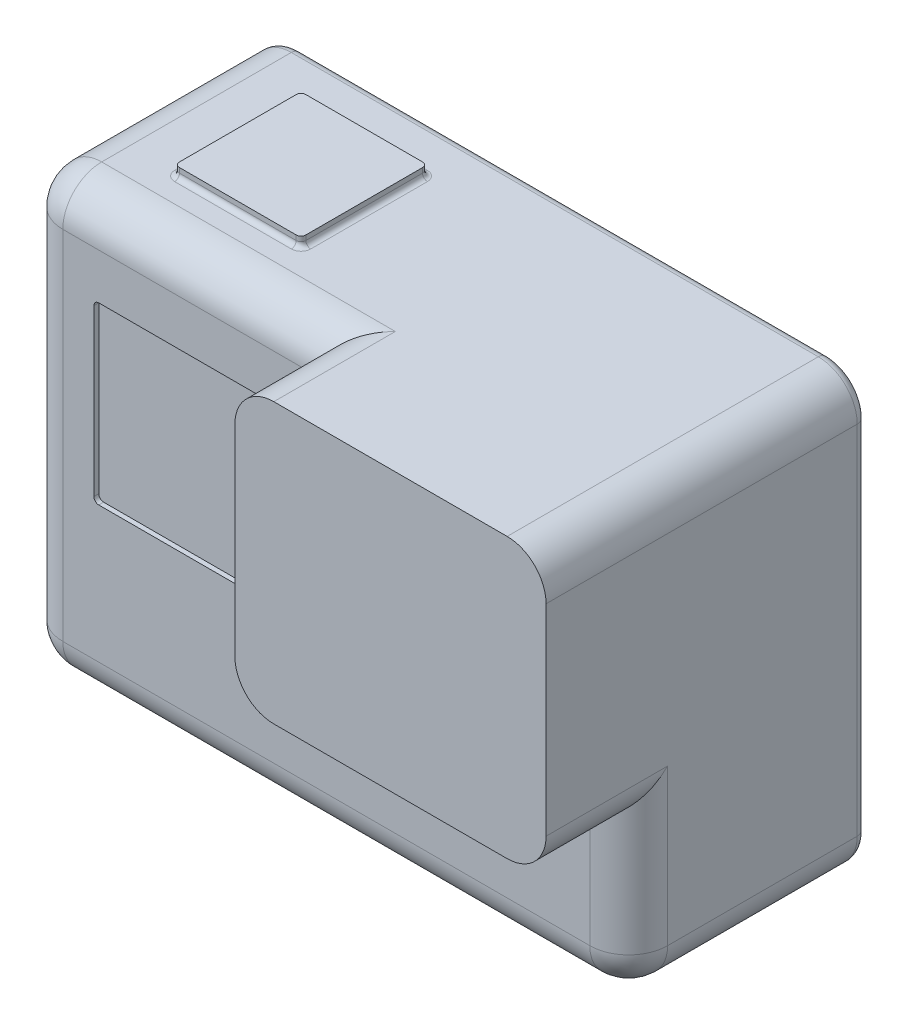
from build123d import *

# Parameters (mm, degrees)
CROQUIS1_W              = 62.2
CROQUIS1_H              = 44.7
SALIENTE_EXTRUIR1_DEPTH = 24.5
CROQUIS2_W              = 32
CROQUIS2_H              = 28.7
SALIENTE_EXTRUIR2_DEPTH = 8.5
CROQUIS3_W              = 18
CROQUIS3_H              = 18
CORTAR_EXTRUIR1_DEPTH   = 0.5
CROQUIS4_W              = 13
CROQUIS4_H              = 13
SALIENTE_EXTRUIR3_DEPTH = 1
REDONDEO2_R             = 0.5
REDONDEO3_R             = 1
REDONDEO1_R             = 4


with BuildPart() as part:
    # Croquis1 → Saliente-Extruir1 (new body)
    with BuildSketch(Plane.XY):
        with Locations((-31.1, 22.35)):
            Rectangle(CROQUIS1_W, CROQUIS1_H)
    extrude(amount=SALIENTE_EXTRUIR1_DEPTH)

    # Croquis2 → Saliente-Extruir2 (add)
    with BuildSketch(Plane.XY.offset(24.5)):
        with Locations((-16, 30.35)):
            Rectangle(CROQUIS2_W, CROQUIS2_H)
    extrude(amount=SALIENTE_EXTRUIR2_DEPTH)

    # Croquis3 → Cortar-Extruir1 (cut)
    with BuildSketch(Plane.XY.offset(24.5)):
        with Locations((-46, 27)):
            Rectangle(CROQUIS3_W, CROQUIS3_H)
    extrude(amount=-CORTAR_EXTRUIR1_DEPTH, mode=Mode.SUBTRACT)

    # Croquis4 → Saliente-Extruir3 (add)
    with BuildSketch(Plane(origin=(0, 44.7, 0), x_dir=(1, 0, 0), z_dir=(0, 1, 0))):
        with Locations((-46.7, -11.5)):
            Rectangle(CROQUIS4_W, CROQUIS4_H)
    extrude(amount=SALIENTE_EXTRUIR3_DEPTH)

    # Redondeo2
    redondeo2_edges = [part.edges().sort_by_distance(p)[0] for p in [
        (-55, 18, 24.25),
        (-55, 36, 24.25),
        (-37, 36, 24.25),
        (-37, 18, 24.25),
        (-40.2, 44.7, 11.5),
        (-40.2, 45.2, 18),
        (-46.7, 44.7, 5),
        (-40.2, 45.2, 5),
        (-53.2, 44.7, 11.5),
        (-53.2, 45.2, 5),
        (-46.7, 44.7, 18),
        (-53.2, 45.2, 18),
    ]]
    fillet(redondeo2_edges, radius=REDONDEO2_R)

    # Redondeo3
    redondeo3_edges = [part.edges().sort_by_distance(p)[0] for p in [
        (-31.1, 0, 0),
        (-62.2, 22.35, 0),
        (-31.1, 44.7, 0),
        (0, 22.35, 0),
    ]]
    fillet(redondeo3_edges, radius=REDONDEO3_R)

    # Redondeo1
    # the kernel refuses this fillet: 4 mm, written as the material it takes off along each edge
    with BuildSketch(Plane(origin=(-4, 40.7, 0), x_dir=(0, 1, 0), z_dir=(-1, 0, 0))) as redondeo1_piece_1:
        with BuildLine():
            CenterArc((3, -1), 1, 0, 90)
            Line((4, -1), (4, 0))
            Line((4, 0), (3, 0))
        make_face()
    revolve(axis=Axis((-4, 40.7, 0), (0, 0, -1)), revolution_arc=90, mode=Mode.SUBTRACT)
    with BuildSketch(Plane(origin=(-4, 4, 0), x_dir=(1, 0, 0), z_dir=(0, 1, 0))) as redondeo1_piece_2:
        with BuildLine():
            CenterArc((3, -1), 1, 0, 90)
            Line((4, -1), (4, 0))
            Line((4, 0), (3, 0))
        make_face()
    revolve(axis=Axis((-4, 4, 0), (0, 0, -1)), revolution_arc=90, mode=Mode.SUBTRACT)
    with BuildSketch(Plane(origin=(-58.2, 40.7, 0), x_dir=(-1, 0, 0), z_dir=(0, -1, 0))) as redondeo1_piece_3:
        with BuildLine():
            CenterArc((3, -1), 1, 0, 90)
            Line((4, -1), (4, 0))
            Line((4, 0), (3, 0))
        make_face()
    revolve(axis=Axis((-58.2, 40.7, 0), (0, 0, -1)), revolution_arc=90, mode=Mode.SUBTRACT)
    with BuildSketch(Plane(origin=(-58.2, 4, 0), x_dir=(0, -1, 0), z_dir=(1, 0, 0))) as redondeo1_piece_4:
        with BuildLine():
            CenterArc((3, -1), 1, 0, 90)
            Line((4, -1), (4, 0))
            Line((4, 0), (3, 0))
        make_face()
    revolve(axis=Axis((-58.2, 4, 0), (0, 0, -1)), revolution_arc=90, mode=Mode.SUBTRACT)
    with BuildSketch(Plane(origin=(-58.2, 4, 20.5), x_dir=(0, 0, 1), z_dir=(0, -1, 0))) as redondeo1_piece_5_section:
        Polygon((0, 0), (REDONDEO1_R, 0), (REDONDEO1_R, REDONDEO1_R), (0, REDONDEO1_R), align=None)
    redondeo1_piece_5 = extrude(amount=REDONDEO1_R, mode=Mode.PRIVATE)
    redondeo1_piece_5 = redondeo1_piece_5 - Plane(origin=(-58.2, 4, 20.5), x_dir=(0.7071067811865475, 0, -0.7071067811865475), z_dir=(0, -1, 0)) * Sphere(REDONDEO1_R, mode=Mode.PRIVATE)
    add(redondeo1_piece_5, mode=Mode.SUBTRACT)
    with BuildSketch(Plane(origin=(-58.2, 40.7, 20.5), x_dir=(0, 0, 1), z_dir=(0, 1, 0))) as redondeo1_piece_6_section:
        Polygon((0, 0), (REDONDEO1_R, 0), (REDONDEO1_R, -REDONDEO1_R), (0, -REDONDEO1_R), align=None)
    redondeo1_piece_6 = extrude(amount=REDONDEO1_R, mode=Mode.PRIVATE)
    redondeo1_piece_6 = redondeo1_piece_6 - Plane(origin=(-58.2, 40.7, 20.5), x_dir=(0.7071067811865475, 0, -0.7071067811865475), z_dir=(0, 1, 0)) * Sphere(REDONDEO1_R, mode=Mode.PRIVATE)
    add(redondeo1_piece_6, mode=Mode.SUBTRACT)
    with BuildSketch(Plane(origin=(-4, 4, 20.5), x_dir=(0, -1, 0), z_dir=(1, 0, 0))) as redondeo1_piece_7_section:
        Polygon((0, 0), (REDONDEO1_R, 0), (REDONDEO1_R, -REDONDEO1_R), (0, -REDONDEO1_R), align=None)
    redondeo1_piece_7 = extrude(amount=REDONDEO1_R, mode=Mode.PRIVATE)
    redondeo1_piece_7 = redondeo1_piece_7 - Plane(origin=(-4, 4, 20.5), x_dir=(0, 0.7071067811865475, -0.7071067811865475), z_dir=(1, 0, 0)) * Sphere(REDONDEO1_R, mode=Mode.PRIVATE)
    add(redondeo1_piece_7, mode=Mode.SUBTRACT)
    with BuildSketch(Plane(origin=(-62.2, 4, 24.5), x_dir=(1, 0, 0), z_dir=(0, 1, 0))) as redondeo1_piece_8:
        with BuildLine():
            CenterArc((REDONDEO1_R, REDONDEO1_R), REDONDEO1_R, 180, 90)
            Line((0, REDONDEO1_R), (0, 0))
            Line((0, 0), (REDONDEO1_R, 0))
        make_face()
    extrude(amount=36.7, mode=Mode.SUBTRACT)
    with BuildSketch(Plane(origin=(-4, 0, 24.5), x_dir=(0, 0, -1), z_dir=(-1, 0, 0))) as redondeo1_piece_9:
        with BuildLine():
            CenterArc((REDONDEO1_R, -REDONDEO1_R), REDONDEO1_R, 90, 90)
            Line((0, -REDONDEO1_R), (0, 0))
            Line((0, 0), (REDONDEO1_R, 0))
        make_face()
    extrude(amount=54.2, mode=Mode.SUBTRACT)
    with BuildSketch(Plane(origin=(-58.2, 44.7, 24.5), x_dir=(0, 0, -1), z_dir=(1, 0, 0))) as redondeo1_piece_10:
        with BuildLine():
            CenterArc((REDONDEO1_R, -REDONDEO1_R), REDONDEO1_R, 90, 90)
            Line((0, -REDONDEO1_R), (0, 0))
            Line((0, 0), (REDONDEO1_R, 0))
        make_face()
    extrude(amount=26.2, mode=Mode.SUBTRACT)
    with BuildSketch(Plane(origin=(0, 16, 24.5), x_dir=(0, 1, 0), z_dir=(0, 0, 1)), Plane(origin=(-32, 16, 24.5), x_dir=(1, 0, 0), z_dir=(0, 0, 1))) as redondeo1_piece_11:
        with BuildLine():
            CenterArc((REDONDEO1_R, REDONDEO1_R), REDONDEO1_R, 180, 90)
            Line((0, REDONDEO1_R), (0, 0))
            Line((0, 0), (REDONDEO1_R, 0))
        make_face()
    extrude(amount=18.5, mode=Mode.SUBTRACT)
    with BuildSketch(Plane(origin=(-32, 44.7, 24.5), x_dir=(1, 0, 0), z_dir=(0, 0, 1))) as redondeo1_piece_12:
        with BuildLine():
            CenterArc((REDONDEO1_R, -REDONDEO1_R), REDONDEO1_R, 90, 90)
            Line((0, -REDONDEO1_R), (0, 0))
            Line((0, 0), (REDONDEO1_R, 0))
        make_face()
    extrude(amount=18.5, mode=Mode.SUBTRACT)
    with BuildSketch(Plane(origin=(0, 16, 24.5), x_dir=(0, 0, -1), z_dir=(0, -1, 0))) as redondeo1_piece_13:
        with BuildLine():
            CenterArc((REDONDEO1_R, -REDONDEO1_R), REDONDEO1_R, 90, 90)
            Line((0, -REDONDEO1_R), (0, 0))
            Line((0, 0), (REDONDEO1_R, 0))
        make_face()
    extrude(amount=12, mode=Mode.SUBTRACT)
    with BuildSketch(Plane(origin=(0, 0, 0), x_dir=(0, 1, 0), z_dir=(0, 0, 1)), Plane(origin=(-62.2, 0, 0), x_dir=(1, 0, 0), z_dir=(0, 0, 1))) as redondeo1_piece_14:
        with BuildLine():
            CenterArc((REDONDEO1_R, REDONDEO1_R), REDONDEO1_R, 180, 90)
            Line((0, REDONDEO1_R), (0, 0))
            Line((0, 0), (REDONDEO1_R, 0))
        make_face()
    extrude(amount=20.5, mode=Mode.SUBTRACT)
    with BuildSketch(Plane(origin=(-62.2, 44.7, 0), x_dir=(1, 0, 0), z_dir=(0, 0, 1))) as redondeo1_piece_15:
        with BuildLine():
            CenterArc((REDONDEO1_R, -REDONDEO1_R), REDONDEO1_R, 90, 90)
            Line((0, -REDONDEO1_R), (0, 0))
            Line((0, 0), (REDONDEO1_R, 0))
        make_face()
    extrude(amount=20.5, mode=Mode.SUBTRACT)
    with BuildSketch(Plane(origin=(0, 44.7, 0), x_dir=(0, -1, 0), z_dir=(0, 0, 1))) as redondeo1_piece_16:
        with BuildLine():
            CenterArc((REDONDEO1_R, -REDONDEO1_R), REDONDEO1_R, 90, 90)
            Line((0, -REDONDEO1_R), (0, 0))
            Line((0, 0), (REDONDEO1_R, 0))
        make_face()
    extrude(amount=43, mode=Mode.SUBTRACT)
    with BuildSketch(Plane(origin=(-58.2, 44.7, 24.5), x_dir=(0, 0, -1), z_dir=(1, 0, 0))) as redondeo1_piece_17a_section:
        with BuildLine():
            CenterArc((REDONDEO1_R, -REDONDEO1_R), REDONDEO1_R, 90, 90)
            Line((0, -REDONDEO1_R), (0, 0))
            Line((0, 0), (REDONDEO1_R, 0))
        make_face()
    redondeo1_piece_17a = extrude(amount=36.2, mode=Mode.PRIVATE)
    redondeo1_piece_17a = split(redondeo1_piece_17a, bisect_by=Plane(origin=(-32, 43.794419543, 23.594419543), z_dir=(1, 0, 0)), keep=Keep.TOP, mode=Mode.PRIVATE)
    with BuildSketch(Plane(origin=(-32, 44.7, 14.5), x_dir=(1, 0, 0), z_dir=(0, 0, 1))) as redondeo1_piece_17b_section:
        with BuildLine():
            CenterArc((REDONDEO1_R, -REDONDEO1_R), REDONDEO1_R, 90, 90)
            Line((0, -REDONDEO1_R), (0, 0))
            Line((0, 0), (REDONDEO1_R, 0))
        make_face()
    redondeo1_piece_17b = extrude(amount=28.5, mode=Mode.PRIVATE)
    redondeo1_piece_17b = split(redondeo1_piece_17b, bisect_by=Plane(origin=(-31.094419543, 43.794419543, 24.5), z_dir=(0, 0, -1)), keep=Keep.TOP, mode=Mode.PRIVATE)
    redondeo1_piece_17 = redondeo1_piece_17a & redondeo1_piece_17b
    add(redondeo1_piece_17, mode=Mode.SUBTRACT)
    with BuildSketch(Plane(origin=(0, 16, 14.5), x_dir=(0, 1, 0), z_dir=(0, 0, 1))) as redondeo1_piece_18a_section:
        with BuildLine():
            CenterArc((REDONDEO1_R, REDONDEO1_R), REDONDEO1_R, 180, 90)
            Line((0, REDONDEO1_R), (0, 0))
            Line((0, 0), (REDONDEO1_R, 0))
        make_face()
    redondeo1_piece_18a = extrude(amount=28.5, mode=Mode.PRIVATE)
    redondeo1_piece_18a = split(redondeo1_piece_18a, bisect_by=Plane(origin=(-0.905580457, 16.905580457, 24.5), z_dir=(0, 0, -1)), keep=Keep.TOP, mode=Mode.PRIVATE)
    with BuildSketch(Plane(origin=(0, 26, 24.5), x_dir=(0, 0, -1), z_dir=(0, -1, 0))) as redondeo1_piece_18b_section:
        with BuildLine():
            CenterArc((REDONDEO1_R, -REDONDEO1_R), REDONDEO1_R, 90, 90)
            Line((0, -REDONDEO1_R), (0, 0))
            Line((0, 0), (REDONDEO1_R, 0))
        make_face()
    redondeo1_piece_18b = extrude(amount=22, mode=Mode.PRIVATE)
    redondeo1_piece_18b = split(redondeo1_piece_18b, bisect_by=Plane(origin=(-0.905580457, 16, 23.594419543), z_dir=(0, 1, 0)), keep=Keep.TOP, mode=Mode.PRIVATE)
    redondeo1_piece_18 = redondeo1_piece_18a & redondeo1_piece_18b
    add(redondeo1_piece_18, mode=Mode.SUBTRACT)


solid = part.part
